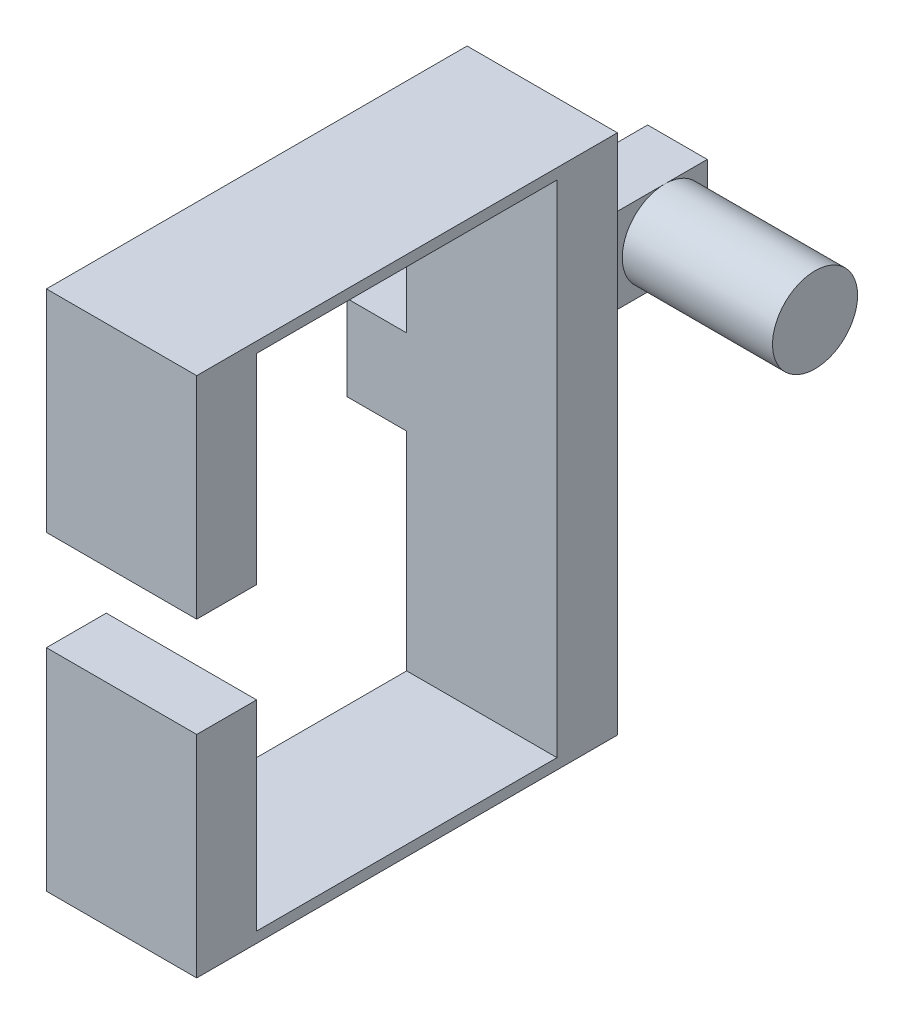
from build123d import *

# Parameters (mm, degrees)
BOSS_EXTRUDE1_DEPTH = 19.05
SKETCH2_W           = 10.777569668
SKETCH2_H           = 38.1
BOSS_EXTRUDE2_DEPTH = 7.561435272
SKETCH3_R           = 5.388784834
BOSS_EXTRUDE3_DEPTH = 19.05


with BuildPart() as part:
    # Sketch1 → Boss-Extrude1 (new body)
    with BuildSketch(Plane.YZ):
        Polygon((0, 0), (0, 53.320566145), (26.73434666, 53.320566145), (26.73434666, 45.732110712), (1.35466666, 45.732110712), (1.35466666, 7.657510712), (64.76322666, 7.657510712), (64.76322666, 45.732110712), (39.38354666, 45.732110712), (39.38354666, 53.320566145), (66.11789332, 53.320566145), (66.11789332, 0), align=None)
    extrude(amount=BOSS_EXTRUDE1_DEPTH)

    # Sketch2 → Boss-Extrude2 (add)
    with BuildSketch(Plane(origin=(0, 0, 0), x_dir=(0, -1, 0), z_dir=(-1, 0, 0))):
        with Locations((-33.05894666, -11.392489288)):
            Rectangle(SKETCH2_W, SKETCH2_H)
    extrude(amount=BOSS_EXTRUDE2_DEPTH)

    # Sketch3 → Boss-Extrude3 (add)
    with BuildSketch(Plane.YZ):
        with Locations((33.05894666, -25.053704453)):
            Circle(SKETCH3_R)
    extrude(amount=BOSS_EXTRUDE3_DEPTH)


solid = part.part
